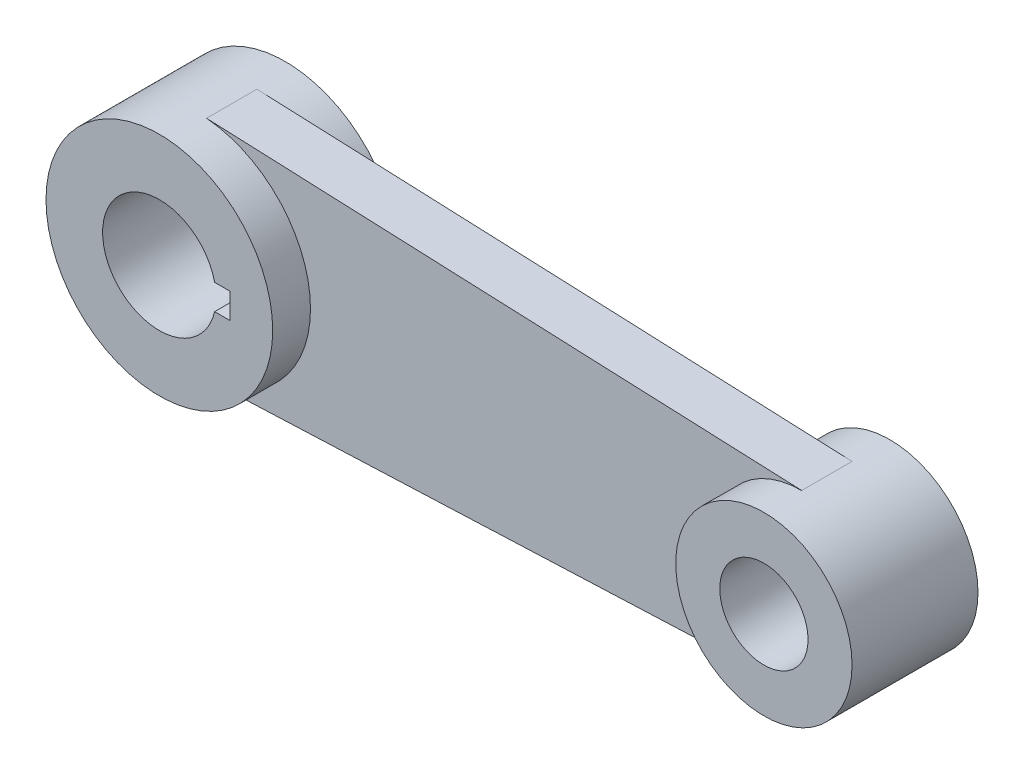
from build123d import *

# Parameters (mm, degrees)
SKETCH1_R             = 56.25
BOSS_EXTRUDE1_DEPTH   = 31.25
SKETCH1_R_2           = 43.75
SKETCH1_R_3           = 21.9
BOSS_EXTRUDE1_2_DEPTH = 31.25
BOSS_EXTRUDE2_DEPTH   = 12.5


with BuildPart() as part:
    # Sketch1 → Boss-Extrude1 (new, symmetric)
    with BuildSketch(Plane.XY):
        Circle(SKETCH1_R)
        with BuildLine():
            Line((35, -6.3), (27.435970914, -6.3))
            ThreePointArc((27.435970914, -6.3), (-28.15, 0), (27.435970914, 6.3))
            Line((27.435970914, 6.3), (35, 6.3))
            Line((35, 6.3), (35, -6.3))
        make_face(mode=Mode.SUBTRACT)
    extrude(amount=BOSS_EXTRUDE1_DEPTH, both=True)



with BuildPart() as body_2:
    # Sketch1 → Boss-Extrude1 2 (new, symmetric)
    with BuildSketch(Plane.XY):
        with Locations((300, 0)):
            Circle(SKETCH1_R_2)
        with Locations((300, 0)):
            Circle(SKETCH1_R_3, mode=Mode.SUBTRACT)
    extrude(amount=BOSS_EXTRUDE1_2_DEPTH, both=True)


with BuildPart() as part_1:
    add(part.part)

    add(body_2.part)  # Boss-Extrude2 merges body 2
    # Sketch2 → Boss-Extrude2 (add, symmetric)
    with BuildSketch(Plane.XY):
        with BuildLine():
            Line((300, 43.75), (4.679376083, 56.055025997))
            ThreePointArc((4.679376083, 56.055025997), (56.25, 0), (4.679376083, -56.055025997))
            Line((4.679376083, -56.055025997), (300, -43.75))
            ThreePointArc((300, -43.75), (256.25, 0), (300, 43.75))
        make_face()
    extrude(amount=BOSS_EXTRUDE2_DEPTH, both=True)


solid = part_1.part
